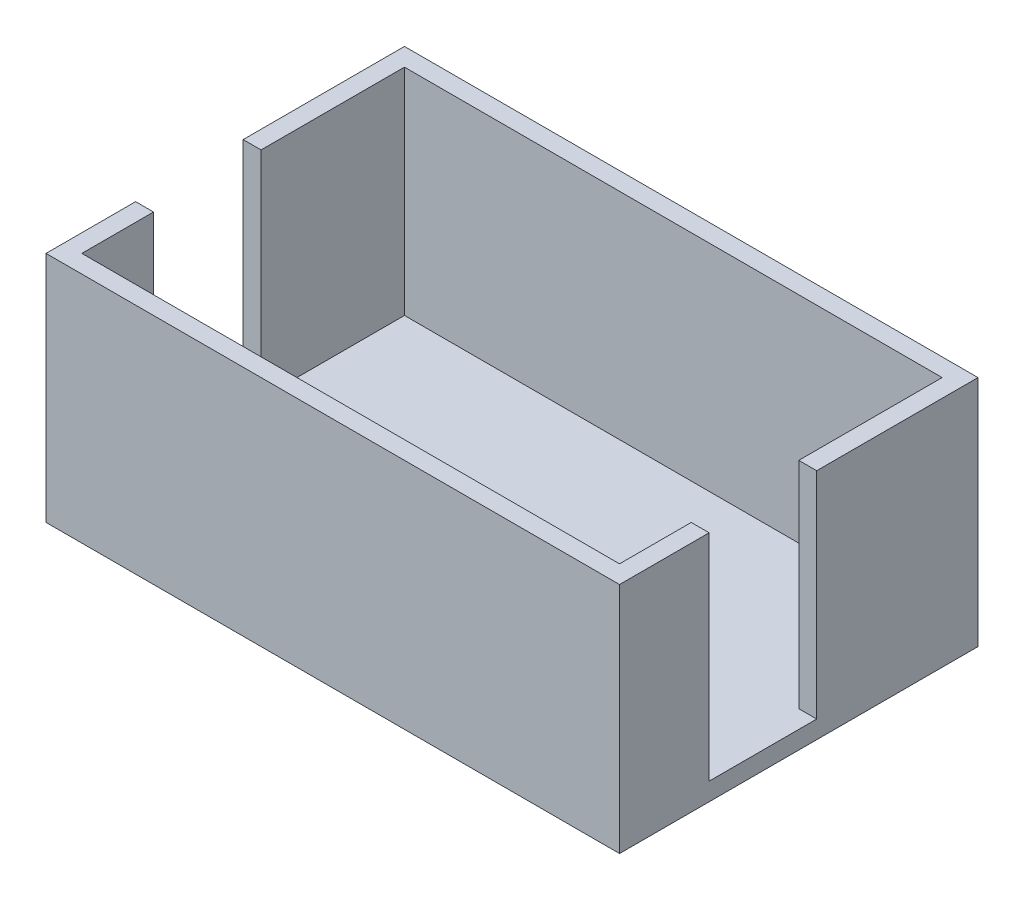
from build123d import *

# Parameters (mm, degrees)
SKETCH1_W           = 160
SKETCH1_H           = 100
BOSS_EXTRUDE1_DEPTH = 5
BOSS_EXTRUDE2_DEPTH = 60


with BuildPart() as part:
    # Sketch1 → Boss-Extrude1 (new body)
    with BuildSketch(Plane(origin=(0, 0, 0), x_dir=(1, 0, 0), z_dir=(0, 1, 0))):
        with Locations((80, 50)):
            Rectangle(SKETCH1_W, SKETCH1_H)
    extrude(amount=BOSS_EXTRUDE1_DEPTH)

    # Sketch3 → Boss-Extrude2 (add)
    with BuildSketch(Plane(origin=(0, 5, 0), x_dir=(1, 0, 0), z_dir=(0, 1, 0))):
        Polygon((5, 5), (5, 25), (0, 25), (0, 0), (160, 0), (160, 25), (155, 25), (155, 5), align=None)
        Polygon((0, 55), (5, 55), (5, 95), (155, 95), (155, 55), (160, 55), (160, 100), (0, 100), align=None)
    extrude(amount=BOSS_EXTRUDE2_DEPTH)


solid = part.part
